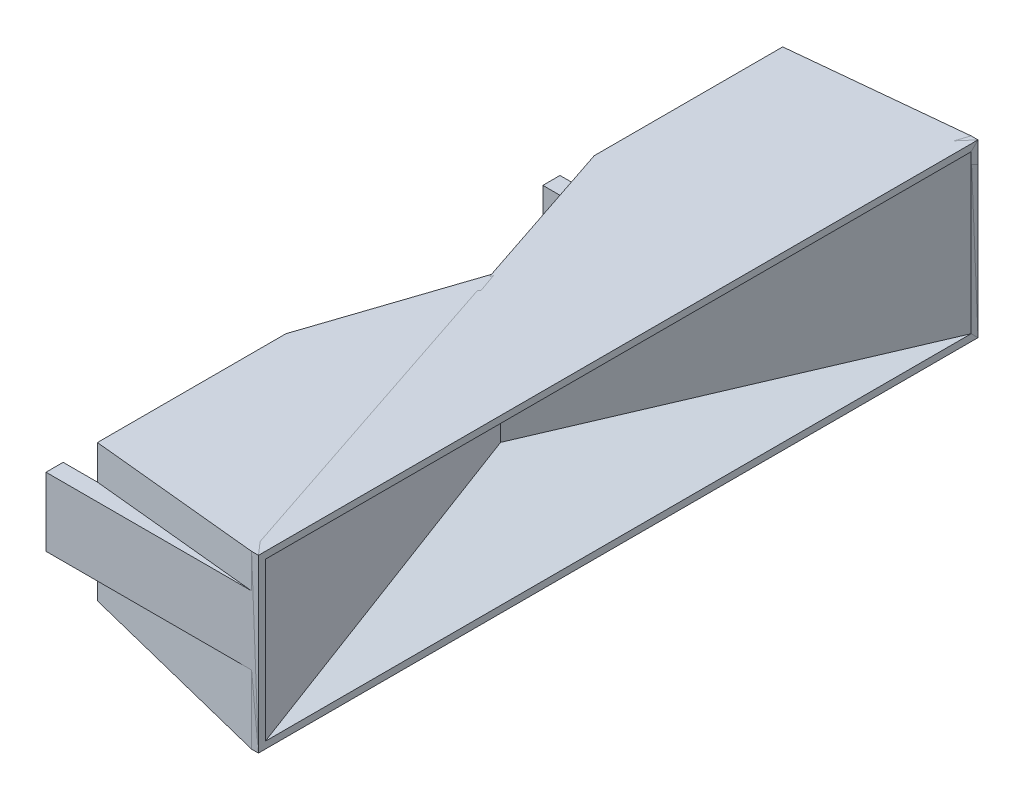
from build123d import *

# Parameters (mm, degrees)
SKETCH1_W             = 210
SKETCH1_H             = 50
SKETCH1_W_2           = 206
SKETCH1_H_2           = 46
BOSS_EXTRUDE3_DEPTH   = 52
SKETCH3_W             = 210
SKETCH3_H             = 50
BOSS_EXTRUDE4_DEPTH   = 2
CHAMFER1_SIZE         = 50
CHAMFER1_SIZE_2       = 5
CHAMFER2_SIZE         = 10
CHAMFER2_SIZE_2       = 50
CHAMFER3_SIZE2        = 150
CHAMFER3_SIZE         = 50
CHAMFER4_SIZE         = 150
CHAMFER4_SIZE2        = 50
CHAMFER5_SIZE         = 10
CHAMFER5_SIZE2        = 50
CHAMFER6_SIZE         = 5
CHAMFER6_SIZE2        = 50
SKETCH4_W             = 51
SKETCH4_H             = 36
CUT_EXTRUDE2_DEPTH    = 2
SKETCH5_W             = 5
SKETCH5_H             = 20
BOSS_EXTRUDE5_DEPTH   = 10
BOSS_EXTRUDE5_2_DEPTH = 10
SKETCH6_W             = 5
SKETCH6_H             = 20
BOSS_EXTRUDE6_DEPTH   = 52
CUT_EXTRUDE3_DEPTH    = 36


# Some blends are built 0.0001 mm under size
with BuildPart() as part:
    # Sketch1 → Boss-Extrude3 (new body)
    with BuildSketch(Plane(origin=(0, 0, 0), x_dir=(0, 0, -1), z_dir=(1, 0, 0))):
        Rectangle(SKETCH1_W, SKETCH1_H)
        Rectangle(SKETCH1_W_2, SKETCH1_H_2, mode=Mode.SUBTRACT)
    extrude(amount=BOSS_EXTRUDE3_DEPTH)

    # Sketch3 → Boss-Extrude4 (add)
    with BuildSketch(Plane.ZY):
        Rectangle(SKETCH3_W, SKETCH3_H)
    extrude(amount=-BOSS_EXTRUDE4_DEPTH)

    # Chamfer1
    # the kernel refuses this chamfer: 50, 5 mm, written as the material it adds along each edge
    with BuildSketch(Plane(origin=(2, 23, 103), x_dir=(0.9999926740665032, 0, 0.0038277687135160926), z_dir=(0, -1, 0))) as chamfer1_piece_1_section:
        Polygon((CHAMFER1_SIZE * 0.999992674067, -CHAMFER1_SIZE * 0.00382776871352), (-CHAMFER1_SIZE_2 * 0.00382776871352, -CHAMFER1_SIZE_2 * 0.999992674067), (0, 0), align=None)
    chamfer1_piece_1 = extrude(amount=46, mode=Mode.PRIVATE)
    chamfer1_piece_1 = split(chamfer1_piece_1, bisect_by=Plane(origin=(52, 0, 101.896942332), z_dir=(-1, 0, 0)), keep=Keep.TOP, mode=Mode.PRIVATE)
    add(chamfer1_piece_1)

    # Chamfer2
    # the kernel refuses this chamfer: 50, 10 mm, written as the material it adds along each edge
    with BuildSketch(Plane(origin=(2, -23, 227.906604315), x_dir=(-0.18544098588999025, 0.9826554028509427, 0), z_dir=(0, 0, -1))) as chamfer2_piece_1_section:
        Polygon((CHAMFER2_SIZE * 0.982655402851, CHAMFER2_SIZE * 0.18544098589), (-CHAMFER2_SIZE_2 * 0.18544098589, CHAMFER2_SIZE_2 * 0.982655402851), (0, 0), align=None)
    chamfer2_piece_1 = extrude(amount=330.906604315, mode=Mode.PRIVATE)
    chamfer2_piece_1 = split(chamfer2_piece_1, bisect_by=Plane(origin=(9.567041137, -20.198584672, 98.756704114), z_dir=(0.09950371902147655, 0, -0.9950371902099414)), keep=Keep.TOP, mode=Mode.PRIVATE)
    chamfer2_piece_1 = split(chamfer2_piece_1, bisect_by=Plane(origin=(52, -20.198584672, -1.619765595), z_dir=(-1, 0, 0)), keep=Keep.TOP, mode=Mode.PRIVATE)
    add(chamfer2_piece_1)

    # Chamfer3
    chamfer3_edges = [part.edges().sort_by_distance(p)[0] for p in [
        (2, 5, -103),
    ]]
    chamfer3_side = [part.faces().sort_by_distance(p)[0] for p in [
        (3, 5, -103),
    ]]
    chamfer(chamfer3_edges, length=CHAMFER3_SIZE - 0.0001, length2=CHAMFER3_SIZE2 - 0.0001, reference=chamfer3_side[0])  # a hair under: the kernel refuses the full size

    # Chamfer4
    chamfer4_edges = [part.edges().sort_by_distance(p)[0] for p in [
        (0, 0, -105),
    ]]
    chamfer4_side = [part.faces().sort_by_distance(p)[0] for p in [
        (0, 0, 0),
    ]]
    chamfer(chamfer4_edges, length=CHAMFER4_SIZE, length2=CHAMFER4_SIZE2, reference=chamfer4_side[0])

    # Chamfer5
    chamfer5_edges = [part.edges().sort_by_distance(p)[0] for p in [
        (0, -25, 75),
    ]]
    chamfer5_side = [part.faces().sort_by_distance(p)[0] for p in [
        (0, 0, 75),
    ]]
    chamfer(chamfer5_edges, length=CHAMFER5_SIZE, length2=CHAMFER5_SIZE2, reference=chamfer5_side[0])

    # Chamfer6
    chamfer6_edges = [part.edges().sort_by_distance(p)[0] for p in [
        (0, 5, 105),
    ]]
    chamfer6_side = [part.faces().sort_by_distance(p)[0] for p in [
        (0, 5, 75),
    ]]
    chamfer(chamfer6_edges, length=CHAMFER6_SIZE, length2=CHAMFER6_SIZE2, reference=chamfer6_side[0])

    # Sketch4 → Cut-Extrude2 (cut)
    with BuildSketch(Plane.ZY):
        with Locations((72.5, 5)):
            Rectangle(SKETCH4_W, SKETCH4_H)
    extrude(amount=-CUT_EXTRUDE2_DEPTH, mode=Mode.SUBTRACT)



with BuildPart() as body_2:
    # Sketch5 → Boss-Extrude5 (new body)
    with BuildSketch(Plane.ZY):
        with Locations((102.5, 5)):
            Rectangle(SKETCH5_W, SKETCH5_H)
    extrude(amount=BOSS_EXTRUDE5_DEPTH)


with BuildPart() as body_3:
    # Sketch5 → Boss-Extrude5 2 (new body)
    with BuildSketch(Plane.ZY):
        with Locations((42.5, 5)):
            Rectangle(SKETCH5_W, SKETCH5_H)
    extrude(amount=BOSS_EXTRUDE5_2_DEPTH)


with BuildPart() as part_1:
    add(part.part)

    add(body_2.part)  # Boss-Extrude6 merges body 2

    add(body_3.part)  # Boss-Extrude6 merges body 3
    # Sketch6 → Boss-Extrude6 (add)
    with BuildSketch(Plane(origin=(0, 0, 0), x_dir=(0, 0, -1), z_dir=(1, 0, 0))):
        with Locations((-42.5, 5)):
            Rectangle(SKETCH6_W, SKETCH6_H)
        with Locations((-102.5, 5)):
            Rectangle(SKETCH6_W, SKETCH6_H)
    extrude(amount=BOSS_EXTRUDE6_DEPTH)

    # Sketch7 → Cut-Extrude3 (cut)
    with BuildSketch(Plane(origin=(0, -13, 0), x_dir=(1, 0, 0), z_dir=(0, 1, 0))):
        Polygon((52, -103), (52, 103), (2, -47), (2, -98), align=None)
    extrude(amount=CUT_EXTRUDE3_DEPTH, mode=Mode.SUBTRACT)


with BuildPart() as body_2_2:
    # Mirror1: mirrored copy
    add(part_1.part.mirror(Plane.XY))

    # Sketch12 → CBORE for M5 Hex Head Bolt2 (revolve, cut)
    with BuildSketch(Plane(origin=(-5, 5, -40), x_dir=(0, -1, 0), z_dir=(1, 0, 0))):
        Polygon((0, 0), (0, 65), (2.25, 65), (2.25, 4.2), (2.5, 4.2), (2.5, 0), align=None)
    revolve(axis=Axis((-5, 5, -33.65), (0, 0, -1)), mode=Mode.SUBTRACT)

    # Sketch14 → CBORE for M5 Hex Head Bolt3 (revolve, cut)
    with BuildSketch(Plane(origin=(-5, 5, -105), x_dir=(0, 1, 0), z_dir=(1, 0, 0))):
        Polygon((0, 0), (0, 210), (2.25, 210), (2.25, 4.2), (2.5, 4.2), (2.5, 0), align=None)
    revolve(axis=Axis((-5, 5, -111.35), (0, 0, 1)), mode=Mode.SUBTRACT)


solid = Compound([part_1.part, body_2_2.part])
